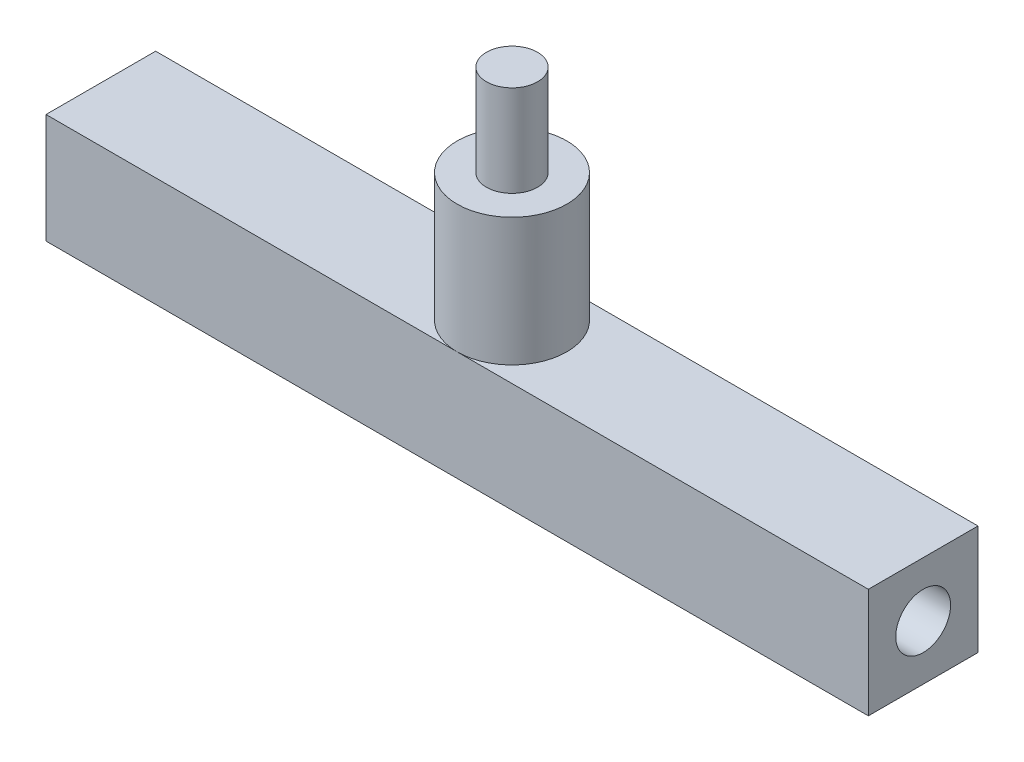
from build123d import *

# Parameters (mm, degrees)
SKETCH1_W                       = 45
SKETCH1_H                       = 6
BOSS_EXTRUDE1_DEPTH             = 6
SKETCH2_R                       = 3
BOSS_EXTRUDE2_DEPTH             = 7
SKETCH3_R                       = 1.4
BOSS_EXTRUDE3_DEPTH             = 5
M3X0_5_TAPPED_HOLE1_D           = 2.5
M3X0_5_TAPPED_HOLE1_DEPTH       = 7.5
M3X0_5_TAPPED_HOLE1_CBORE_D     = 3
M3X0_5_TAPPED_HOLE1_CBORE_DEPTH = 6
M3X0_5_TAPPED_HOLE1_TIP         = 0.751075774
M3X0_5_TAPPED_HOLE2_D           = 2.5
M3X0_5_TAPPED_HOLE2_DEPTH       = 7.5
M3X0_5_TAPPED_HOLE2_CBORE_D     = 3
M3X0_5_TAPPED_HOLE2_CBORE_DEPTH = 6
M3X0_5_TAPPED_HOLE2_TIP         = 0.751075774


with BuildPart() as part:
    # Sketch1 → Boss-Extrude1 (new body)
    with BuildSketch(Plane(origin=(0, 0, 0), x_dir=(1, 0, 0), z_dir=(0, 1, 0))):
        with Locations((22.5, 3)):
            Rectangle(SKETCH1_W, SKETCH1_H)
    extrude(amount=BOSS_EXTRUDE1_DEPTH)

    # Sketch2 → Boss-Extrude2 (add)
    with BuildSketch(Plane(origin=(0, 6, 0), x_dir=(1, 0, 0), z_dir=(0, 1, 0))):
        with Locations((22.5, 3)):
            Circle(SKETCH2_R)
    extrude(amount=BOSS_EXTRUDE2_DEPTH)

    # Sketch3 → Boss-Extrude3 (add)
    with BuildSketch(Plane(origin=(0, 13, 0), x_dir=(1, 0, 0), z_dir=(0, 1, 0))):
        with Locations((22.5, 3)):
            Circle(SKETCH3_R)
    extrude(amount=BOSS_EXTRUDE3_DEPTH)

    # M3x0.5 Tapped Hole1
    with Locations(Plane(origin=(45, 0, 0), x_dir=(0, 0, -1), z_dir=(1, 0, 0))):
        with Locations((3, 3)):
            CounterBoreHole(M3X0_5_TAPPED_HOLE1_D / 2, M3X0_5_TAPPED_HOLE1_CBORE_D / 2, M3X0_5_TAPPED_HOLE1_CBORE_DEPTH, depth=M3X0_5_TAPPED_HOLE1_DEPTH)
            with Locations((0, 0, -(M3X0_5_TAPPED_HOLE1_DEPTH + M3X0_5_TAPPED_HOLE1_TIP / 2))):  # 118° drill point
                Cone(0, M3X0_5_TAPPED_HOLE1_D / 2, M3X0_5_TAPPED_HOLE1_TIP, mode=Mode.SUBTRACT)

    # M3x0.5 Tapped Hole2
    with Locations(Plane.ZY):
        with Locations((-3, 3)):
            CounterBoreHole(M3X0_5_TAPPED_HOLE2_D / 2, M3X0_5_TAPPED_HOLE2_CBORE_D / 2, M3X0_5_TAPPED_HOLE2_CBORE_DEPTH, depth=M3X0_5_TAPPED_HOLE2_DEPTH)
            with Locations((0, 0, -(M3X0_5_TAPPED_HOLE2_DEPTH + M3X0_5_TAPPED_HOLE2_TIP / 2))):  # 118° drill point
                Cone(0, M3X0_5_TAPPED_HOLE2_D / 2, M3X0_5_TAPPED_HOLE2_TIP, mode=Mode.SUBTRACT)


solid = part.part
